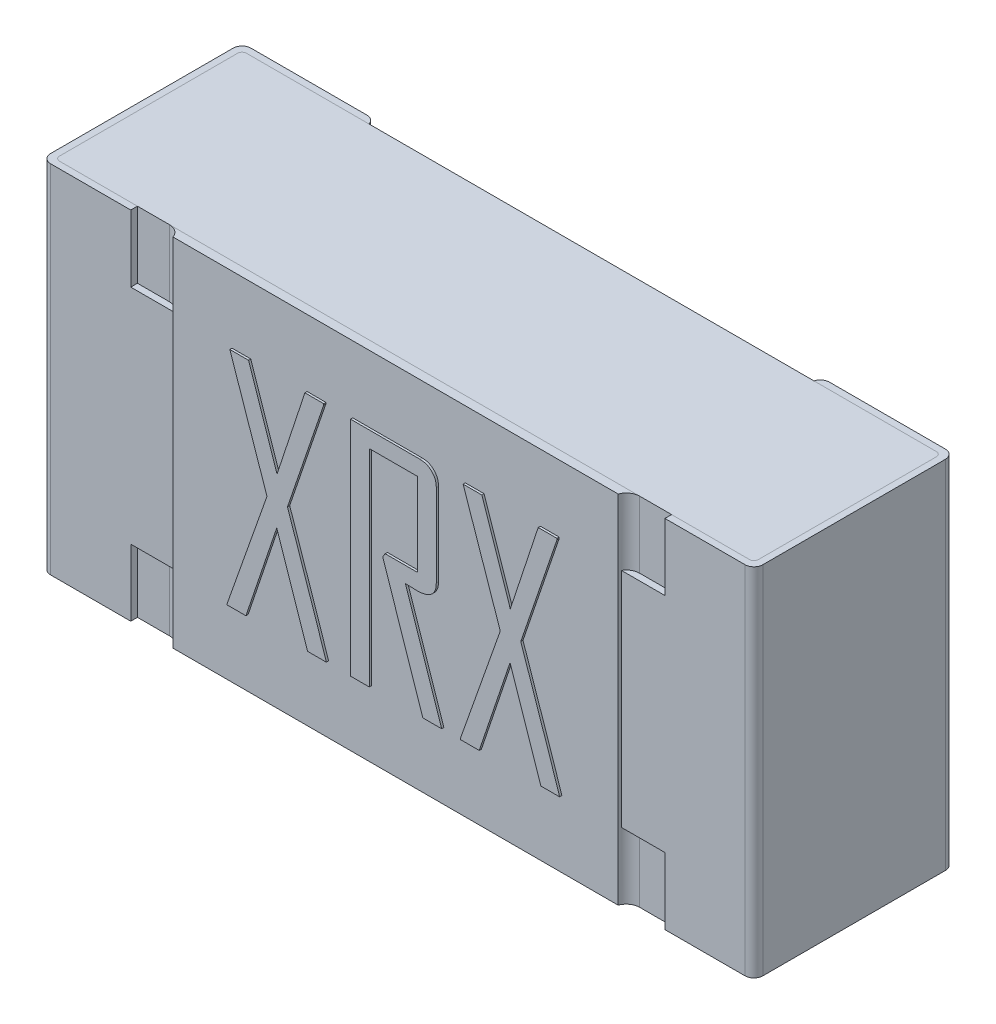
from build123d import *

# Parameters (mm, degrees)
SKETCH1_W                        = 1.6
SKETCH1_H                        = 0.8
ALL_BODY_EXTRUDE_DEPTH           = 0.45
SKETCH3_W                        = 1.2
SKETCH3_H                        = 0.15
CUT_OUT_FOR_PIN_UPPER_DEPTH      = 0.015
SKETCH2_W                        = 1
SKETCH2_H                        = 0.8
CUT_OUT_FOR_PIN_LOWER_DEPTH      = 0.015
SKETCH4_W                        = 1
SKETCH4_H                        = 0.8
COATING_EXTRUDE_DEPTH            = 0.02
COATING_START                    = -0.4
COATING_FILLET_DEPTH             = 0.8
BODY_CUT_OUT_FOR_TOTAL_PIN_DEPTH = 2.219436345
BODY_EXTRUDE_DEPTH               = 0.8
PIN_FILLET_R                     = 0.02
RESISTANT_VALUE_DEPTH            = 0.005


with BuildPart() as part:
    # Sketch1 → All body extrude (new body)
    with BuildSketch(Plane.XY):
        Rectangle(SKETCH1_W, SKETCH1_H)
    extrude(amount=ALL_BODY_EXTRUDE_DEPTH)

    # Sketch3 → Cut out for pin-upper (cut)
    with BuildSketch(Plane.XY.offset(0.45)):
        with Locations((0, 0.325)):
            Rectangle(SKETCH3_W, SKETCH3_H)
        with Locations((0, -0.325)):
            Rectangle(SKETCH3_W, SKETCH3_H)
    extrude(amount=-CUT_OUT_FOR_PIN_UPPER_DEPTH, mode=Mode.SUBTRACT)

    # Sketch2 → Cut out for pin-lower (cut)
    with BuildSketch(Plane(origin=(0, 0, 0), x_dir=(-1, 0, 0), z_dir=(0, 0, -1))):
        Rectangle(SKETCH2_W, SKETCH2_H)
    extrude(amount=-CUT_OUT_FOR_PIN_LOWER_DEPTH, mode=Mode.SUBTRACT)

    # Sketch4 → Coating extrude (add)
    with BuildSketch(Plane.XY.offset(0.435)):
        Rectangle(SKETCH4_W, SKETCH4_H)
    extrude(amount=COATING_EXTRUDE_DEPTH)

    # Coating fillet: read off the stored shape, not the designer's step
    # Coating fillet outline → Coating fillet (add)
    with BuildSketch(Plane(origin=(0, 0, 0), x_dir=(1, 0, 0), z_dir=(0, 1, 0)).offset(COATING_START)):
        with BuildLine():
            Line((-0.5, -0.435), (-0.528284271, -0.435))
            ThreePointArc((-0.528284271, -0.435), (-0.510963763, -0.440505103), (-0.5, -0.455))
            Line((-0.5, -0.455), (-0.5, -0.435))
        make_face()
        with BuildLine():
            ThreePointArc((0.5, -0.455), (0.510963763, -0.440505103), (0.528284271, -0.435))
            Line((0.528284271, -0.435), (0.5, -0.435))
            Line((0.5, -0.435), (0.5, -0.455))
        make_face()
    extrude(amount=COATING_FILLET_DEPTH)

    # Sketch6 → Body cut out for total pin (cut, through all)
    with BuildSketch(Plane.XZ.offset(0.4)):
        with BuildLine():
            Line((-0.775, 0.435), (0.775, 0.435))
            ThreePointArc((0.775, 0.435), (0.782071068, 0.432071068), (0.785, 0.425))
            Line((0.785, 0.425), (0.785, 0.025))
            ThreePointArc((0.785, 0.025), (0.782071068, 0.017928932), (0.775, 0.015))
            Line((0.775, 0.015), (-0.775, 0.015))
            ThreePointArc((-0.775, 0.015), (-0.782071068, 0.017928932), (-0.785, 0.025))
            Line((-0.785, 0.025), (-0.785, 0.425))
            ThreePointArc((-0.785, 0.425), (-0.782071068, 0.432071068), (-0.775, 0.435))
        make_face()
    extrude(amount=-BODY_CUT_OUT_FOR_TOTAL_PIN_DEPTH, mode=Mode.SUBTRACT)

    # Pin fillet
    # the kernel refuses this fillet: 0.02 mm, written as the material it takes off along each edge
    with BuildSketch(Plane(origin=(0.8, 0.45, 0.45), x_dir=(-1, 0, 0), z_dir=(0, -1, 0)), Plane(origin=(-0.8, -0.45, 0.45), x_dir=(1, 0, 0), z_dir=(0, 1, 0))) as pin_fillet_piece_1:
        with BuildLine():
            CenterArc((PIN_FILLET_R, PIN_FILLET_R), PIN_FILLET_R, 180, 90)
            Line((0, PIN_FILLET_R), (-PIN_FILLET_R * 0.02, PIN_FILLET_R))
            Line((-PIN_FILLET_R * 0.02, PIN_FILLET_R), (-PIN_FILLET_R * 0.02, -PIN_FILLET_R * 0.02))
            Line((-PIN_FILLET_R * 0.02, -PIN_FILLET_R * 0.02), (PIN_FILLET_R, -PIN_FILLET_R * 0.02))
            Line((PIN_FILLET_R, -PIN_FILLET_R * 0.02), (PIN_FILLET_R, 0))
        make_face()
    extrude(amount=0.9, mode=Mode.SUBTRACT)
    with BuildSketch(Plane(origin=(0.8, 0.45, 0), x_dir=(-1, 0, 0), z_dir=(0, -1, 0)), Plane(origin=(-0.8, -0.45, 0), x_dir=(1, 0, 0), z_dir=(0, 1, 0))) as pin_fillet_piece_2:
        with BuildLine():
            CenterArc((PIN_FILLET_R, -PIN_FILLET_R), PIN_FILLET_R, 90, 90)
            Line((0, -PIN_FILLET_R), (-PIN_FILLET_R * 0.02, -PIN_FILLET_R))
            Line((-PIN_FILLET_R * 0.02, -PIN_FILLET_R), (-PIN_FILLET_R * 0.02, PIN_FILLET_R * 0.02))
            Line((-PIN_FILLET_R * 0.02, PIN_FILLET_R * 0.02), (PIN_FILLET_R, PIN_FILLET_R * 0.02))
            Line((PIN_FILLET_R, PIN_FILLET_R * 0.02), (PIN_FILLET_R, 0))
        make_face()
    extrude(amount=0.9, mode=Mode.SUBTRACT)
    with BuildSketch(Plane(origin=(0.5, -0.448412292, 0), x_dir=(1, 0, 0), z_dir=(0, 1, 0)), Plane(origin=(-0.5, 0.448412292, 0), x_dir=(-1, 0, 0), z_dir=(0, -1, 0))) as pin_fillet_piece_3:
        with BuildLine():
            CenterArc((0.019364917, -0.02), PIN_FILLET_R, 90, 75.522487815)
            Line((0, -0.015), (-0.000387298, -0.0149))
            ThreePointArc((-0.000387298, -0.0149), (-0.0004, -0.0075), (-0.0004, 0))
            Line((-0.0004, 0), (0, 0.0004))
            Line((0, 0.0004), (0.019364917, 0.0004))
            Line((0.019364917, 0.0004), (0.019364917, 0))
        make_face()
    extrude(amount=0.896824584, mode=Mode.SUBTRACT)

    # Sketch21 → Resistant Value (add)
    with BuildSketch(Plane.XY.offset(0.455)):
        with BuildLine():
            Line((-0.15060241, -0.25), (-0.192771084, -0.25))
            Line((-0.192771084, -0.25), (-0.262048193, -0.044521837))
            Line((-0.262048193, -0.044521837), (-0.331325301, -0.25))
            Line((-0.331325301, -0.25), (-0.373493976, -0.25))
            add(Edge.make_bspline(
                [(-0.373493976, -0.25), (-0.373493976, -0.249403865), (-0.373493976, -0.248556727), (-0.373493976, -0.247709588), (-0.373493976, -0.247458584)],
                knots=[0, 0, 0, 0, 1.407407407, 2, 2, 2, 2], degree=3))
            Line((-0.373493976, -0.247458584), (-0.283979669, 0.00592997))
            add(Edge.make_bspline(
                [(-0.283979669, 0.00592997), (-0.287369221, 0.015718776), (-0.293940494, 0.034696181), (-0.303446592, 0.062202007), (-0.312168651, 0.087868229), (-0.320381964, 0.111568972), (-0.327929901, 0.133431579), (-0.334762854, 0.153430926), (-0.340996532, 0.171527269), (-0.34654818, 0.187717652), (-0.351444062, 0.202024454), (-0.355681131, 0.214448656), (-0.359258467, 0.224990776), (-0.362181609, 0.233648362), (-0.364427248, 0.240399454), (-0.366041932, 0.245256043), (-0.367040359, 0.248222645), (-0.367378694, 0.249622676), (-0.36746988, 0.25)],
                knots=[0, 0, 0, 0, 1.927553832, 3.736918121, 5.415158206, 6.971588422, 8.404311079, 9.718847863, 10.904156158, 11.965757829, 12.903653443, 13.717843825, 14.408330246, 14.975114804, 15.418201358, 15.732054334, 15.927785727, 16, 16, 16, 16], degree=3))
            Line((-0.36746988, 0.25), (-0.325301205, 0.25))
            Line((-0.325301205, 0.25), (-0.261483434, 0.060240964))
            Line((-0.261483434, 0.060240964), (-0.198795181, 0.25))
            Line((-0.198795181, 0.25), (-0.156626506, 0.25))
            add(Edge.make_bspline(
                [(-0.156626506, 0.25), (-0.156626506, 0.24937249), (-0.156626506, 0.248399849), (-0.156626506, 0.247427209), (-0.156626506, 0.247082078)],
                knots=[0, 0, 0, 0, 1.290322581, 2, 2, 2, 2], degree=3))
            Line((-0.156626506, 0.247082078), (-0.237951807, 0.008471386))
            add(Edge.make_bspline(
                [(-0.237951807, 0.008471386), (-0.234408977, -0.001914794), (-0.227547533, -0.022029835), (-0.217562137, -0.051164243), (-0.208340778, -0.078315791), (-0.199782271, -0.103449949), (-0.191844395, -0.126583788), (-0.184731148, -0.147755234), (-0.178229466, -0.166891911), (-0.172335744, -0.184024219), (-0.167338787, -0.199218059), (-0.162857649, -0.212376503), (-0.159104979, -0.223508598), (-0.156088206, -0.232679019), (-0.153744651, -0.239836115), (-0.152021819, -0.244993203), (-0.151051417, -0.248165867), (-0.1506947, -0.249623007), (-0.15060241, -0.25)],
                knots=[0, 0, 0, 0, 1.93058992, 3.738997214, 5.418215154, 6.975249619, 8.410101043, 9.72099315, 10.904472811, 11.965768803, 12.908346819, 13.718273231, 14.411244822, 14.975048819, 15.416667524, 15.73610151, 15.931723813, 16, 16, 16, 16], degree=3))
        make_face()
        with BuildLine():
            Line((0.108433735, -0.25), (0.06626506, -0.25))
            Line((0.06626506, -0.25), (-0.024096386, 0.018166416))
            Line((-0.024096386, 0.018166416), (-0.018542922, 0.027108434))
            Line((-0.018542922, 0.027108434), (0.054216867, 0.027108434))
            Line((0.054216867, 0.027108434), (0.054216867, 0.213855422))
            Line((0.054216867, 0.213855422), (-0.054216867, 0.213855422))
            Line((-0.054216867, 0.213855422), (-0.054216867, -0.25))
            Line((-0.054216867, -0.25), (-0.096385542, -0.25))
            Line((-0.096385542, -0.25), (-0.096385542, 0.25))
            Line((-0.096385542, 0.25), (0.059487952, 0.25))
            add(Edge.make_bspline(
                [(0.059487952, 0.25), (0.062103971, 0.249877071), (0.067127481, 0.249641012), (0.074331978, 0.247718101), (0.080709581, 0.244381847), (0.086177901, 0.239792359), (0.090767389, 0.234324039), (0.094103644, 0.227946436), (0.096026554, 0.220741939), (0.096262613, 0.215718429), (0.096385542, 0.21310241)],
                knots=[0, 0, 0, 0, 1.071910697, 2.058377219, 3.031150369, 4, 4.968849631, 5.941622781, 6.928089303, 8, 8, 8, 8], degree=3))
            Line((0.096385542, 0.21310241), (0.096385542, 0.027861446))
            add(Edge.make_bspline(
                [(0.096385542, 0.027861446), (0.096286982, 0.024959336), (0.09610082, 0.019477825), (0.093960612, 0.011801913), (0.090480524, 0.005210807), (0.085378935, -8.8619e-05), (0.078988486, -0.004252378), (0.071141568, -0.006967465), (0.062020416, -0.008806596), (0.055451353, -0.00895645), (0.051957831, -0.009036145)],
                knots=[0, 0, 0, 0, 1.052138315, 1.987280534, 2.870062918, 3.733182423, 4.631443151, 5.616429111, 6.732383034, 8, 8, 8, 8], degree=3))
            add(Edge.make_bspline(
                [(0.051957831, -0.009036145), (0.050137627, -0.009017433), (0.045835371, -0.008973205), (0.039124877, -0.008572511), (0.032571995, -0.008164128), (0.02848936, -0.008114925), (0.026826054, -0.00809488)],
                knots=[0, 0, 0, 0, 0.868317512, 2.052364952, 3.206514152, 4, 4, 4, 4], degree=3))
            add(Edge.make_bspline(
                [(0.026826054, -0.00809488), (0.040459525, -0.048344081), (0.067761401, -0.128945617), (0.09486473, -0.209614133), (0.108433735, -0.25)],
                knots=[0, 0, 0, 0, 0.998720468, 2, 2, 2, 2], degree=3))
        make_face()
        with BuildLine():
            Line((0.373493976, -0.25), (0.331325301, -0.25))
            Line((0.331325301, -0.25), (0.262048193, -0.044521837))
            Line((0.262048193, -0.044521837), (0.192771084, -0.25))
            Line((0.192771084, -0.25), (0.15060241, -0.25))
            add(Edge.make_bspline(
                [(0.15060241, -0.25), (0.15060241, -0.249403865), (0.15060241, -0.248556727), (0.15060241, -0.247709588), (0.15060241, -0.247458584)],
                knots=[0, 0, 0, 0, 1.407407407, 2, 2, 2, 2], degree=3))
            Line((0.15060241, -0.247458584), (0.240116717, 0.00592997))
            add(Edge.make_bspline(
                [(0.240116717, 0.00592997), (0.236727164, 0.015718776), (0.230155892, 0.034696181), (0.220649794, 0.062202007), (0.211927734, 0.087868229), (0.203714422, 0.111568972), (0.196166485, 0.133431579), (0.189333531, 0.153430926), (0.183099854, 0.171527269), (0.177548206, 0.187717652), (0.172652324, 0.202024454), (0.168415254, 0.214448656), (0.164837919, 0.224990776), (0.161914777, 0.233648362), (0.159669137, 0.240399454), (0.158054454, 0.245256043), (0.157056026, 0.248222645), (0.156717691, 0.249622676), (0.156626506, 0.25)],
                knots=[0, 0, 0, 0, 1.927553832, 3.736918121, 5.415158206, 6.971588422, 8.404311079, 9.718847863, 10.904156158, 11.965757829, 12.903653443, 13.717843825, 14.408330246, 14.975114804, 15.418201358, 15.732054334, 15.927785727, 16, 16, 16, 16], degree=3))
            Line((0.156626506, 0.25), (0.198795181, 0.25))
            Line((0.198795181, 0.25), (0.262612952, 0.060240964))
            Line((0.262612952, 0.060240964), (0.325301205, 0.25))
            Line((0.325301205, 0.25), (0.36746988, 0.25))
            add(Edge.make_bspline(
                [(0.36746988, 0.25), (0.36746988, 0.24937249), (0.36746988, 0.248399849), (0.36746988, 0.247427209), (0.36746988, 0.247082078)],
                knots=[0, 0, 0, 0, 1.290322581, 2, 2, 2, 2], degree=3))
            Line((0.36746988, 0.247082078), (0.286144578, 0.008471386))
            add(Edge.make_bspline(
                [(0.286144578, 0.008471386), (0.289687409, -0.001914794), (0.296548852, -0.022029835), (0.306534249, -0.051164243), (0.315755608, -0.078315791), (0.324314114, -0.103449949), (0.332251991, -0.126583788), (0.339365238, -0.147755234), (0.345866919, -0.166891911), (0.351760642, -0.184024219), (0.356757599, -0.199218059), (0.361238737, -0.212376503), (0.364991407, -0.223508598), (0.36800818, -0.232679019), (0.370351735, -0.239836115), (0.372074566, -0.244993203), (0.373044968, -0.248165867), (0.373401685, -0.249623007), (0.373493976, -0.25)],
                knots=[0, 0, 0, 0, 1.93058992, 3.738997214, 5.418215154, 6.975249619, 8.410101043, 9.72099315, 10.904472811, 11.965768803, 12.908346819, 13.718273231, 14.411244822, 14.975048819, 15.416667524, 15.73610151, 15.931723813, 16, 16, 16, 16], degree=3))
        make_face()
    extrude(amount=RESISTANT_VALUE_DEPTH)


with BuildPart() as body_2:
    # Sketch7 → Body extrude (new, through all)
    with BuildSketch(Plane(origin=(0, -0.4, 0), x_dir=(1, 0, 0), z_dir=(0, 1, 0))):
        with BuildLine():
            Line((-0.775, -0.435), (0.775, -0.435))
            ThreePointArc((0.775, -0.435), (0.782071068, -0.432071068), (0.785, -0.425))
            Line((0.785, -0.425), (0.785, -0.025))
            ThreePointArc((0.785, -0.025), (0.782071068, -0.017928932), (0.775, -0.015))
            Line((0.775, -0.015), (-0.775, -0.015))
            ThreePointArc((-0.775, -0.015), (-0.782071068, -0.017928932), (-0.785, -0.025))
            Line((-0.785, -0.025), (-0.785, -0.425))
            ThreePointArc((-0.785, -0.425), (-0.782071068, -0.432071068), (-0.775, -0.435))
        make_face()
    extrude(amount=BODY_EXTRUDE_DEPTH)


solid = Compound([part.part, body_2.part])
